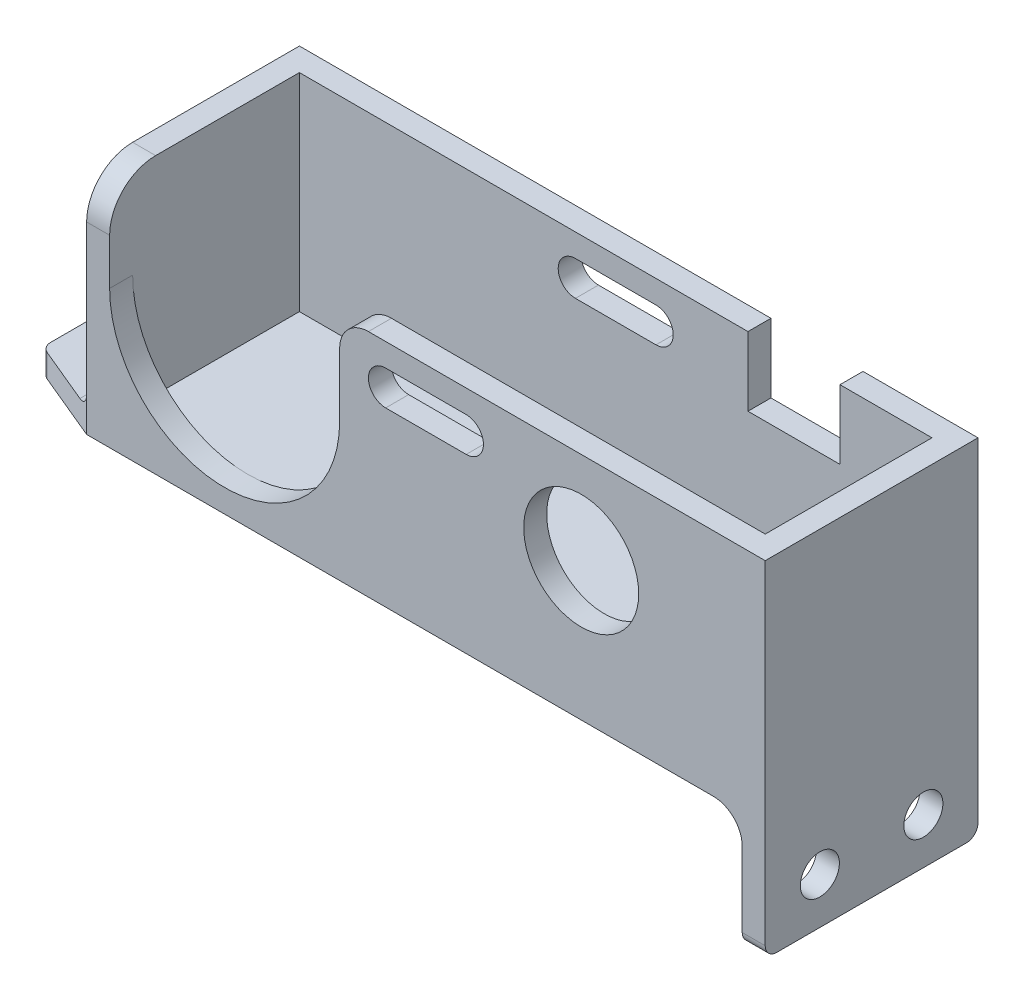
from build123d import *

# Parameters (mm, degrees)
SKETCH1_W               = 55
SKETCH1_H               = 18
BOSS_EXTRUDE1_DEPTH     = 7.25
SHELL2_T                = 2
LENS_CUTOUT_REACH       = 38.517
POWER_BUTTON_HOLE_REACH = 38.517
SKETCH12_R              = 5
POWER_CORD_CUTOUT_REACH = 38.517
SKETCH13_W              = 8
SKETCH13_H              = 6
CUT_EXTRUDE4_DEPTH      = 37.517119273
FILLET4_R               = 2.5
BOSS_EXTRUDE3_DEPTH     = 2
M3_CLEARANCE_HOLE1_D    = 3.4
FILLET2_R               = 1
SKETCH18_W              = 2
SKETCH18_H              = 18.5
BOSS_EXTRUDE4_DEPTH     = 10
M3_CLEARANCE_HOLE2_D    = 3.4
FILLET3_R               = 2.5
FILLET5_R               = 4
FILLET6_R               = 1


with BuildPart() as part:
    # Sketch1 → Boss-Extrude1 (new, symmetric)
    with BuildSketch(Plane.XY):
        Rectangle(SKETCH1_W, SKETCH1_H)
    extrude(amount=BOSS_EXTRUDE1_DEPTH, both=True)

    # Shell2
    shell2_openings = [part.faces().sort_by_distance(p)[0] for p in [
        (0, 9, 0),
    ]]
    offset(amount=SHELL2_T, openings=shell2_openings, kind=Kind.INTERSECTION)

    # Sketch11 → lens cutout (cut, up to next)
    with BuildSketch(Plane.XY.offset(9.25), mode=Mode.PRIVATE) as lens_cutout_sk1:
        with BuildLine():
            Line((-27.5, 9), (-27.5, 1))
            ThreePointArc((-27.5, 1), (-17.5, -9), (-7.5, 1))
            Line((-7.5, 1), (-7.5, 9))
            Line((-7.5, 9), (-27.5, 9))
        make_face()
    lens_cutout_tool1 = extrude(lens_cutout_sk1.sketch, amount=-LENS_CUTOUT_REACH, mode=Mode.PRIVATE) & part.part
    add(lens_cutout_tool1.solids().sort_by_distance((-17.5, 0.915899, 9.25))[0], mode=Mode.SUBTRACT)

    # Sketch12 → power button hole (cut, up to next)
    with BuildSketch(Plane.XY.offset(9.25), mode=Mode.PRIVATE) as power_button_hole_sk1:
        with Locations((13.5, 1)):
            Circle(SKETCH12_R)
    power_button_hole_tool1 = extrude(power_button_hole_sk1.sketch, amount=-POWER_BUTTON_HOLE_REACH, mode=Mode.PRIVATE) & part.part
    add(power_button_hole_tool1.solids().sort_by_distance((13.5, 1, 9.25))[0], mode=Mode.SUBTRACT)

    # Sketch13 → power cord cutout (cut, up to next)
    with BuildSketch(Plane(origin=(0, 0, -9.25), x_dir=(-1, 0, 0), z_dir=(0, 0, -1)), mode=Mode.PRIVATE) as power_cord_cutout_sk1:
        with Locations((-15.5, 6)):
            Rectangle(SKETCH13_W, SKETCH13_H)
    power_cord_cutout_tool1 = extrude(power_cord_cutout_sk1.sketch, amount=-POWER_CORD_CUTOUT_REACH, mode=Mode.PRIVATE) & part.part
    add(power_cord_cutout_tool1.solids().sort_by_distance((15.5, 6, -9.25))[0], mode=Mode.SUBTRACT)

    # Sketch21 → Cut-Extrude4 (cut, through all)
    with BuildSketch(Plane.XY.offset(9.25)):
        with BuildLine():
            Line((-3.5, 7), (3.5, 7))
            ThreePointArc((3.5, 7), (5, 5.5), (3.5, 4))
            Line((3.5, 4), (-3.5, 4))
            ThreePointArc((-3.5, 4), (-5, 5.5), (-3.5, 7))
        make_face()
    extrude(amount=-CUT_EXTRUDE4_DEPTH, mode=Mode.SUBTRACT)

    # Fillet4
    fillet4_edges = [part.edges().sort_by_distance(p)[0] for p in [
        (-7.5, 9, 8.25),
    ]]
    fillet(fillet4_edges, radius=FILLET4_R)

    # Sketch15 → Boss-Extrude3 (add)
    with BuildSketch(Plane.XZ.offset(11)):
        Polygon((-29.5, 9.25), (-29.5, -9.25), (-36, -11.96461114), (-36, 6.53538886), align=None)
    extrude(amount=-BOSS_EXTRUDE3_DEPTH)

    # M3 Clearance Hole1 (through all)
    with Locations(Plane(origin=(0, -9, 0), x_dir=(1, 0, 0), z_dir=(0, 1, 0))):
        with Locations((-32.75, -2.64269443), (-32.75, 5.35730557)):
            Hole(M3_CLEARANCE_HOLE1_D / 2)

    # Fillet2
    fillet2_edges = [part.edges().sort_by_distance(p)[0] for p in [
        (-29.5, -9, 0),
    ]]
    fillet(fillet2_edges, radius=FILLET2_R)

    # Sketch18 → Boss-Extrude4 (add)
    with BuildSketch(Plane.XZ.offset(11)):
        with Locations((28.5, 0)):
            Rectangle(SKETCH18_W, SKETCH18_H)
    extrude(amount=BOSS_EXTRUDE4_DEPTH)

    # M3 Clearance Hole2 (through all)
    with Locations(Plane.ZY.offset(-27.5)):
        with Locations((-4.5, -17), (4.5, -17)):
            Hole(M3_CLEARANCE_HOLE2_D / 2)

    # Fillet3
    fillet3_edges = [part.edges().sort_by_distance(p)[0] for p in [
        (27.5, -11, 0),
    ]]
    fillet(fillet3_edges, radius=FILLET3_R)

    # Fillet5
    fillet5_edges = [part.edges().sort_by_distance(p)[0] for p in [
        (-28.5, 9, 9.25),
    ]]
    fillet(fillet5_edges, radius=FILLET5_R)

    # Fillet6
    fillet6_edges = [part.edges().sort_by_distance(p)[0] for p in [
        (28.5, -21, -9.25),
        (28.5, -21, 9.25),
        (-36, -10, -11.96461114),
        (-36, -10, 6.53538886),
    ]]
    fillet(fillet6_edges, radius=FILLET6_R)


solid = part.part
